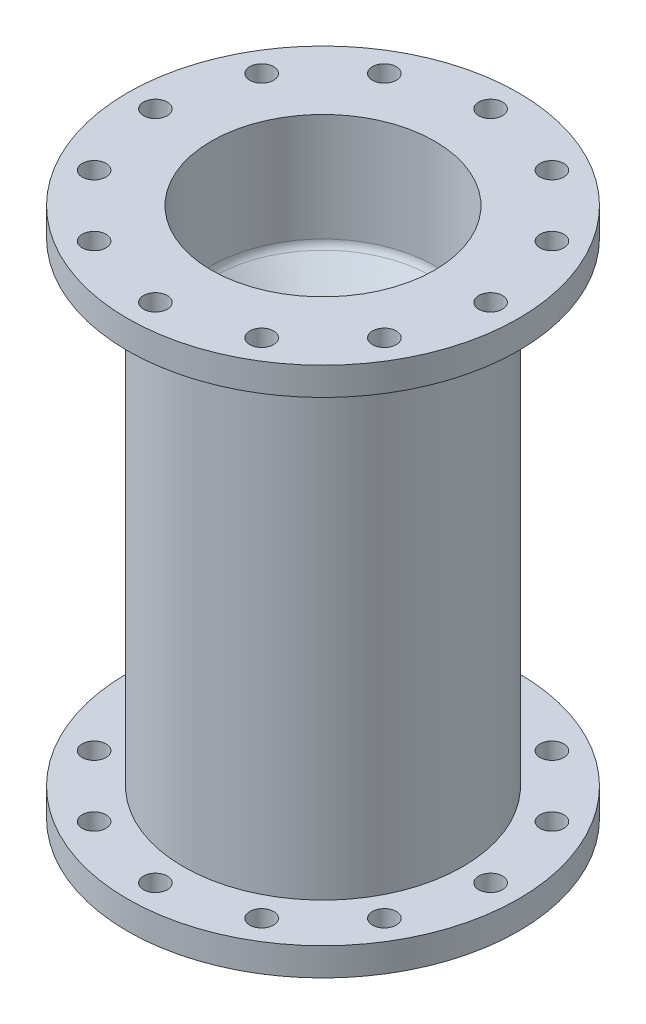
from build123d import *

# Parameters (mm, degrees)
F_3_0_213_DIAMETER_HOLE3_D = 5.4102


with BuildPart() as part:
    # Sketch1 → Chamber (revolve)
    with BuildSketch(Plane(origin=(0, 0, 0), x_dir=(0, 0, -1), z_dir=(1, 0, 0))):
        Polygon((31.75, 6.35), (31.75, 114.3), (44.45, 114.3), (44.45, 120.65), (31.75, 120.65), (25.4, 120.65), (25.4, 114.3), (25.4, 6.35), (25.4, 0), (31.75, 0), (44.45, 0), (44.45, 6.35), align=None)
    revolve(axis=Axis((0, 0, 0), (0, 1, 0)))

    # Sketch4 → Turbulence Rings (revolve)
    with BuildSketch(Plane(origin=(0, 0, 0), x_dir=(0, 0, -1), z_dir=(1, 0, 0))):
        with BuildLine():
            Line((24.658792055, 94.442500424), (7.62, 77.403708368))
            Line((7.62, 77.403708368), (7.62, 74.863708368))
            Line((7.62, 74.863708368), (21.063948776, 88.307657144))
            ThreePointArc((21.063948776, 88.307657144), (23.832015918, 88.858259932), (25.4, 86.51160592))
            Line((25.4, 86.51160592), (25.402732203, 96.231931135))
            ThreePointArc((25.402732203, 96.231931135), (25.20812607, 95.263478275), (24.658792055, 94.442500424))
        make_face()
    revolve(axis=Axis((0, 0, 0), (0, 1, 0)))

    # #3 (0.213) Diameter Hole3 (through all)
    with Locations(Plane(origin=(0, 120.65, 0), x_dir=(1, 0, 0), z_dir=(0, 1, 0))):
        with Locations((0, 0), (-38.1, 0), (-32.995567884, 19.05), (-19.05, 32.995567884), (0, 38.1), (19.05, 32.995567884), (32.995567884, 19.05), (38.1, 0), (32.995567884, -19.05), (19.05, -32.995567884), (0, -38.1), (-19.05, -32.995567884), (-32.995567884, -19.05)):
            Hole(F_3_0_213_DIAMETER_HOLE3_D / 2)


solid = part.part
